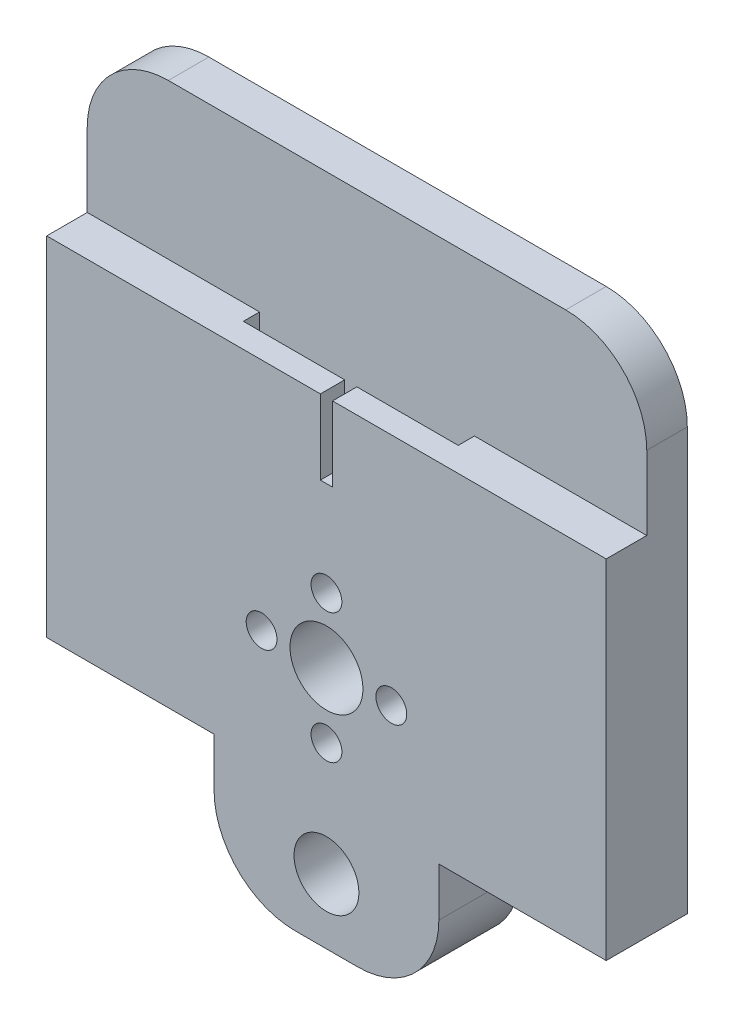
from build123d import *

# Parameters (mm, degrees)
BOSS_EXTRUDE1_DEPTH     = 10
SKETCH2_R               = 4
SKETCH2_R_2             = 4.5
SKETCH2_R_3             = 1.9
CUT_EXTRUDE1_DEPTH      = 54.021222166
CUT_EXTRUDE2_DEPTH      = 80.887420787
CUT_EXTRUDE2_DEPTH_BACK = 80.887420787
SKETCH5_W               = 1.5
SKETCH5_H               = 9.2075
CUT_EXTRUDE4_DEPTH      = 5
SKETCH6_W               = 12.5
SKETCH6_H               = 2
CUT_EXTRUDE5_DEPTH      = 9.954
SKETCH7_W               = 12.5
SKETCH7_H               = 2
CUT_EXTRUDE6_DEPTH      = 9.954
FILLET2_R               = 10
FILLET3_R               = 10
SKETCH8_R               = 1.25
CUT_EXTRUDE7_DEPTH      = 16


with BuildPart() as part:
    # Sketch1 → Boss-Extrude1 (new body)
    with BuildSketch(Plane.XY):
        Polygon((-34.5, 39), (34.5, 39), (34.5, -23), (13.861088822, -23), (13.861088822, -39), (-13.861088822, -39), (-13.861088822, -23), (-34.5, -23), align=None)
    extrude(amount=BOSS_EXTRUDE1_DEPTH)

    # Sketch2 → Cut-Extrude1 (cut, through all)
    with BuildSketch(Plane.XY.offset(10)):
        with Locations((0, -31)):
            Circle(SKETCH2_R)
        with Locations((0, -9)):
            Circle(SKETCH2_R_2)
        with Locations((0, -1)):
            Circle(SKETCH2_R_3)
        with Locations((8, -9)):
            Circle(SKETCH2_R_3)
        with Locations((0, -17)):
            Circle(SKETCH2_R_3)
        with Locations((-8, -9)):
            Circle(SKETCH2_R_3)
    extrude(amount=-CUT_EXTRUDE1_DEPTH, mode=Mode.SUBTRACT)

    # Sketch4 → Cut-Extrude2 (cut, two sides: drawn at the far end of the back side and taken through both)
    with BuildSketch(Plane.ZY.offset(34.5).offset(-CUT_EXTRUDE2_DEPTH_BACK)):
        Polygon((5, 205.320184237), (5, 39), (5, 19.9), (10, 19.9), (176.320184237, 19.9), (420.638340398, 245.639348163), (249.318156161, 431.0595324), align=None)
    extrude(amount=CUT_EXTRUDE2_DEPTH + CUT_EXTRUDE2_DEPTH_BACK, mode=Mode.SUBTRACT)

    # Sketch5 → Cut-Extrude4 (cut)
    with BuildSketch(Plane.XY.offset(10)):
        with Locations((0, 15.29625)):
            Rectangle(SKETCH5_W, SKETCH5_H)
    extrude(amount=-CUT_EXTRUDE4_DEPTH, mode=Mode.SUBTRACT)

    # Sketch6 → Cut-Extrude5 (cut)
    with BuildSketch(Plane(origin=(0, 19.9, 0), x_dir=(1, 0, 0), z_dir=(0, 1, 0))):
        with Locations((-7, -6)):
            Rectangle(SKETCH6_W, SKETCH6_H)
    extrude(amount=-CUT_EXTRUDE5_DEPTH, mode=Mode.SUBTRACT)

    # Sketch7 → Cut-Extrude6 (cut)
    with BuildSketch(Plane(origin=(0, 19.9, 0), x_dir=(1, 0, 0), z_dir=(0, 1, 0))):
        with Locations((7, -6)):
            Rectangle(SKETCH7_W, SKETCH7_H)
    extrude(amount=-CUT_EXTRUDE6_DEPTH, mode=Mode.SUBTRACT)

    # Fillet2
    fillet2_edges = [part.edges().sort_by_distance(p)[0] for p in [
        (13.861088822, -39, 5),
        (-13.861088822, -39, 5),
    ]]
    fillet(fillet2_edges, radius=FILLET2_R)

    # Fillet3
    fillet3_edges = [part.edges().sort_by_distance(p)[0] for p in [
        (-34.5, 39, 2.5),
        (34.5, 39, 2.5),
    ]]
    fillet(fillet3_edges, radius=FILLET3_R)

    # Sketch8 → Cut-Extrude7 (cut)
    with BuildSketch(Plane.XZ.offset(23)):
        with Locations((-29.251747084, 3)):
            Circle(SKETCH8_R)
        with Locations((-19.251747084, 3)):
            Circle(SKETCH8_R)
    cut_extrude7 = extrude(amount=-CUT_EXTRUDE7_DEPTH, mode=Mode.SUBTRACT)

    # Mirror1: Cut-Extrude7 across plane
    add(cut_extrude7.mirror(Plane.ZY), mode=Mode.SUBTRACT)


solid = part.part
